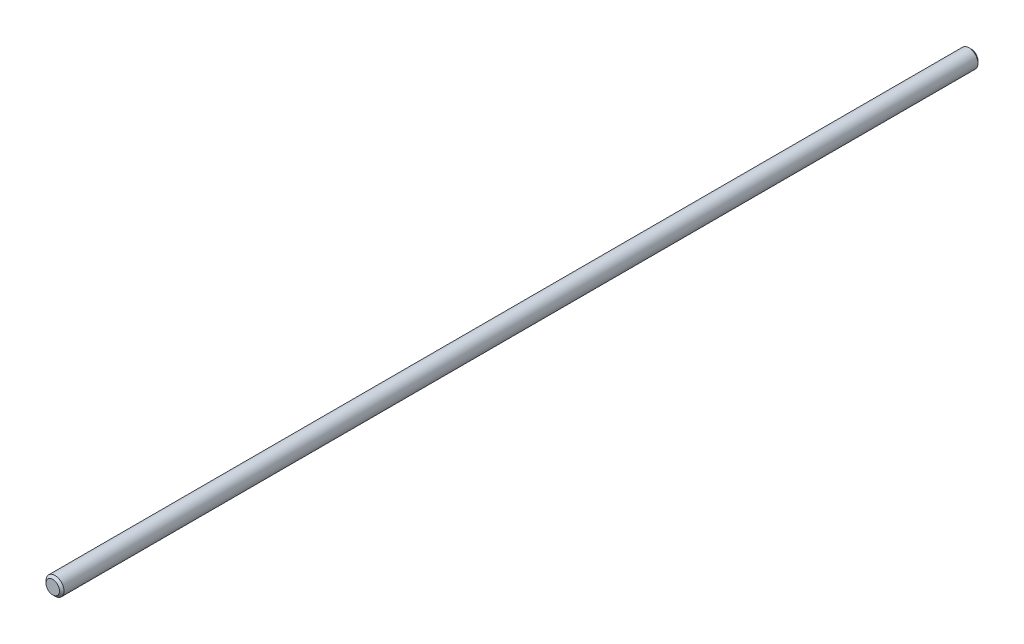
from build123d import *

# Parameters (mm, degrees)
SKETCH1_R           = 4
BOSS_EXTRUDE1_DEPTH = 408
CHAMFER1_SIZE       = 1


with BuildPart() as part:
    # Sketch1 → Boss-Extrude1 (new body)
    with BuildSketch(Plane.XY):
        Circle(SKETCH1_R)
    extrude(amount=BOSS_EXTRUDE1_DEPTH)

    # Chamfer1
    chamfer1_edges = [part.edges().sort_by_distance(p)[0] for p in [
        (-4, 0, 408),
        (-4, 0, 0),
    ]]
    chamfer(chamfer1_edges, length=CHAMFER1_SIZE)


solid = part.part
